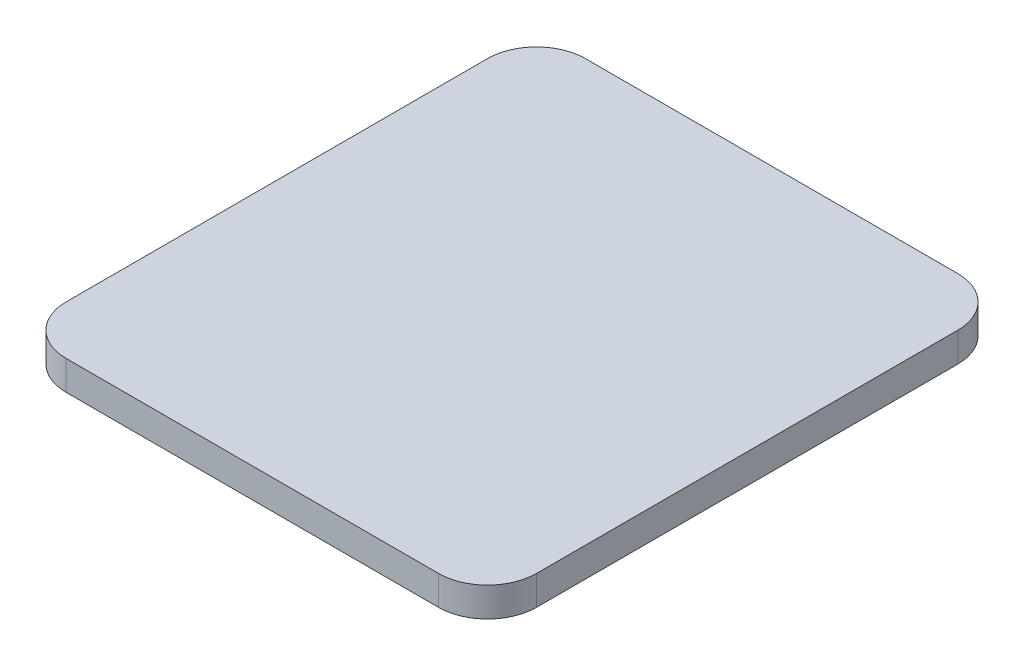
from build123d import *

# Parameters (mm, degrees)
BOSS_EXTRUDE1_DEPTH = 3


with BuildPart() as part:
    # Sketch1 → Boss-Extrude1 (new body)
    with BuildSketch(Plane.XZ.offset(-24.671825564)):
        with BuildLine():
            Line((13.921525611, 29.780531955), (51.921525611, 29.780531955))
            ThreePointArc((51.921525611, 29.780531955), (55.457059517, 31.244998049), (56.921525611, 34.780531955))
            Line((56.921525611, 34.780531955), (56.921525611, 77.780531955))
            ThreePointArc((56.921525611, 77.780531955), (55.457059517, 81.316065861), (51.921525611, 82.780531955))
            Line((51.921525611, 82.780531955), (13.921525611, 82.780531955))
            ThreePointArc((13.921525611, 82.780531955), (10.385991705, 81.316065861), (8.921525611, 77.780531955))
            Line((8.921525611, 77.780531955), (8.921525611, 34.780531955))
            ThreePointArc((8.921525611, 34.780531955), (10.385991705, 31.244998049), (13.921525611, 29.780531955))
        make_face()
    extrude(amount=BOSS_EXTRUDE1_DEPTH)


solid = part.part
